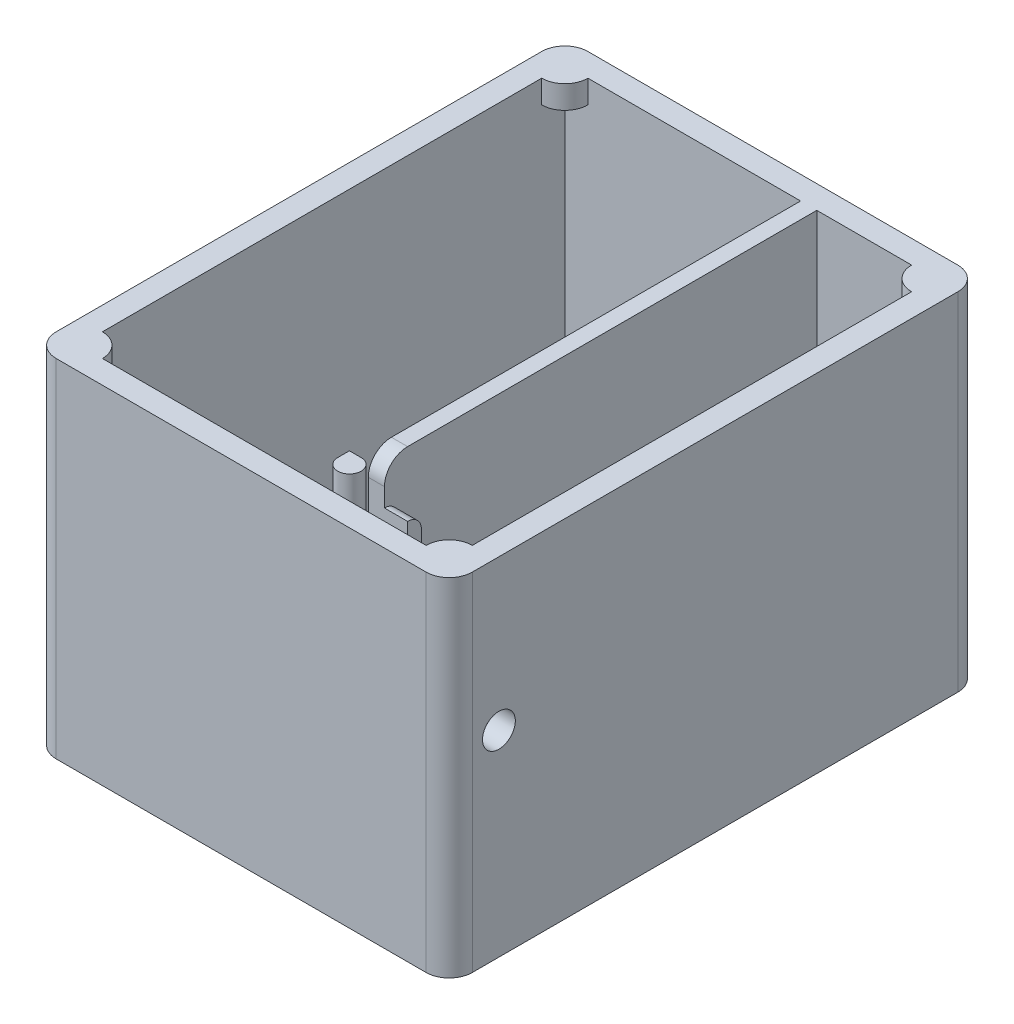
from build123d import *
from build123d.topology import SkipClean

# Parameters (mm, degrees)
SKETCH1_W                = 90
SKETCH1_H                = 115
BOSS_EXTRUDE1_DEPTH      = 70
SKETCH6_W                = 32
SKETCH6_H                = 11.5
CUT_EXTRUDE2_DEPTH       = 65.5
CUT_EXTRUDE11_DEPTH      = 125.222582488
CUT_EXTRUDE11_DEPTH_BACK = 125.222582488
SKETCH22_R               = 3.55
SKETCH2_W                = 25.5
SKETCH2_H                = 90.5
CUT_EXTRUDE12_DEPTH      = 65.5
SKETCH23_W               = 15.5
SKETCH23_H               = 55.5
CUT_EXTRUDE13_DEPTH      = 3
SKETCH24_W               = 14.034874412
SKETCH24_H               = 3
CUT_EXTRUDE14_DEPTH      = 3
FILLET2_R                = 5
FILLET3_R                = 5
FILLET4_R                = 5
FILLET5_R                = 5
SKETCH37_W               = 51
SKETCH37_H               = 105
CUT_EXTRUDE15_DEPTH      = 65.5
BOSS_EXTRUDE3_DEPTH      = 21.5
BOSS_EXTRUDE4_START      = 5
SKETCH44_R               = 5
BOSS_EXTRUDE4_DEPTH      = 5
BOSS_EXTRUDE6_START      = 5
SKETCH48_W               = 80
SKETCH48_H               = 5
SKETCH48_W_2             = 5
SKETCH48_H_2             = 105
BOSS_EXTRUDE6_DEPTH      = 5
SKETCH53_W               = 3.5
SKETCH53_H               = 93.5
BOSS_EXTRUDE7_DEPTH      = 5
SKETCH54_W               = 25.5
SKETCH54_H               = 3
CUT_EXTRUDE16_DEPTH      = 4
CUT_EXTRUDE17_DEPTH      = 5
CUT_EXTRUDE18_START      = -5
CUT_EXTRUDE18_DEPTH      = 5
FILLET6_R                = 5


with BuildPart() as part:
    # Sketch1 → Boss-Extrude1 (new body)
    with BuildSketch(Plane(origin=(0, 0, 0), x_dir=(1, 0, 0), z_dir=(0, 1, 0))):
        Rectangle(SKETCH1_W, SKETCH1_H)
    extrude(amount=BOSS_EXTRUDE1_DEPTH)

    # Sketch6 → Cut-Extrude2 (cut)
    with BuildSketch(Plane(origin=(0, 70, 0), x_dir=(1, 0, 0), z_dir=(0, 1, 0))):
        with Locations((24, -46.75)):
            Rectangle(SKETCH6_W, SKETCH6_H)
    extrude(amount=-CUT_EXTRUDE2_DEPTH, mode=Mode.SUBTRACT)

    # Sketch22 → Cut-Extrude11 (cut, two sides: drawn at the far end of the back side and taken through both)
    with BuildSketch(Plane.ZY.offset(-40).offset(-CUT_EXTRUDE11_DEPTH_BACK)):
        with Locations((46.75, 42.5)):
            Circle(SKETCH22_R)
    extrude(amount=CUT_EXTRUDE11_DEPTH + CUT_EXTRUDE11_DEPTH_BACK, mode=Mode.SUBTRACT)

    # Sketch2 → Cut-Extrude12 (cut)
    with BuildSketch(Plane(origin=(0, 70, 0), x_dir=(1, 0, 0), z_dir=(0, 1, 0))):
        with Locations((27.25, 7.25)):
            Rectangle(SKETCH2_W, SKETCH2_H)
    extrude(amount=-CUT_EXTRUDE12_DEPTH, mode=Mode.SUBTRACT)

    # Sketch23 → Cut-Extrude13 (cut)
    with BuildSketch(Plane(origin=(0, 0, 38), x_dir=(-1, 0, 0), z_dir=(0, 0, -1))):
        with Locations((-27.25, 38.25)):
            Rectangle(SKETCH23_W, SKETCH23_H)
    extrude(amount=-CUT_EXTRUDE13_DEPTH, mode=Mode.SUBTRACT)

    # Sketch24 → Cut-Extrude14 (cut)
    with BuildSketch(Plane(origin=(0, 0, 38), x_dir=(-1, 0, 0), z_dir=(0, 0, -1))):
        with Locations((-14.5, 19.5)):
            Rectangle(SKETCH24_W, SKETCH24_H)
    extrude(amount=-CUT_EXTRUDE14_DEPTH, mode=Mode.SUBTRACT)

    # Fillet2
    fillet2_edges = [part.edges().sort_by_distance(p)[0] for p in [
        (-45, 35, 57.5),
    ]]
    fillet(fillet2_edges, radius=FILLET2_R)

    # Fillet3
    fillet3_edges = [part.edges().sort_by_distance(p)[0] for p in [
        (45, 35, 57.5),
    ]]
    fillet(fillet3_edges, radius=FILLET3_R)

    # Fillet4
    fillet4_edges = [part.edges().sort_by_distance(p)[0] for p in [
        (45, 35, -57.5),
    ]]
    fillet(fillet4_edges, radius=FILLET4_R)

    # Fillet5
    fillet5_edges = [part.edges().sort_by_distance(p)[0] for p in [
        (-45, 35, -57.5),
    ]]
    fillet(fillet5_edges, radius=FILLET5_R)

    # Sketch37 → Cut-Extrude15 (cut)
    with BuildSketch(Plane(origin=(0, 70, 0), x_dir=(1, 0, 0), z_dir=(0, 1, 0))):
        with Locations((-14.5, 0)):
            Rectangle(SKETCH37_W, SKETCH37_H)
    extrude(amount=-CUT_EXTRUDE15_DEPTH, mode=Mode.SUBTRACT)

    # Sketch39 → Boss-Extrude3 (add)
    with BuildSketch(Plane(origin=(0, 4.5, 0), x_dir=(1, 0, 0), z_dir=(0, 1, 0))):
        with BuildLine():
            Line((10.8, 3.38), (10.8, 5.92))
            Line((10.8, 5.92), (8.26, 5.92))
            ThreePointArc((8.26, 5.92), (6.463948776, 1.583948776), (10.8, 3.38))
        make_face()
        with BuildLine():
            ThreePointArc((10.8, -49.96), (6.463948776, -48.163948776), (8.26, -52.5))
            Line((8.26, -52.5), (10.8, -52.5))
            Line((10.8, -52.5), (10.8, -49.96))
        make_face()
        with BuildLine():
            ThreePointArc((-37.46, -52.5), (-35.663948776, -48.163948776), (-40, -49.96))
            Line((-40, -49.96), (-40, -52.5))
            Line((-40, -52.5), (-37.46, -52.5))
        make_face()
        with BuildLine():
            Line((-37.46, 5.92), (-40, 5.92))
            Line((-40, 5.92), (-40, 3.38))
            ThreePointArc((-40, 3.38), (-35.663948776, 1.583948776), (-37.46, 5.92))
        make_face()
    extrude(amount=BOSS_EXTRUDE3_DEPTH)

    # Sketch44 → Boss-Extrude4 (add)
    with SkipClean():  # the faces are left unmerged after this step: merging them gives an invalid solid
        with BuildSketch(Plane(origin=(0, 70, 0), x_dir=(1, 0, 0), z_dir=(0, 1, 0)).offset(BOSS_EXTRUDE4_START)):
            with Locations((40, 52.5)):
                Circle(SKETCH44_R)
            with Locations((-40, 52.5)):
                Circle(SKETCH44_R)
            with Locations((-40, -52.5)):
                Circle(SKETCH44_R)
            with Locations((40, -52.5)):
                Circle(SKETCH44_R)
        extrude(amount=-BOSS_EXTRUDE4_DEPTH)

    # Sketch48 → Boss-Extrude6 (add)
    with SkipClean():  # the faces are left unmerged after this step: merging them gives an invalid solid
        with BuildSketch(Plane(origin=(0, 70, 0), x_dir=(1, 0, 0), z_dir=(0, 1, 0)).offset(BOSS_EXTRUDE6_START)):
            with Locations((0, 55)):
                Rectangle(SKETCH48_W, SKETCH48_H)
            with Locations((-42.5, 0)):
                Rectangle(SKETCH48_W_2, SKETCH48_H_2)
            with BuildLine():
                Line((45, -52.5), (45, 52.5))
                ThreePointArc((45, 52.5), (43.535533906, 48.964466094), (40, 47.5))
                Line((40, 47.5), (40, -47.5))
                ThreePointArc((40, -47.5), (43.535533906, -48.964466094), (45, -52.5))
            make_face()
            with Locations((0, -55)):
                Rectangle(SKETCH48_W, SKETCH48_H)
        extrude(amount=-BOSS_EXTRUDE6_DEPTH)
    add(part.part.scale(1), mode=Mode.REPLACE)  # the faces are merged on a copy

    # Sketch53 → Boss-Extrude7 (add)
    with BuildSketch(Plane(origin=(0, 70, 0), x_dir=(1, 0, 0), z_dir=(0, 1, 0))):
        with Locations((12.75, 5.75)):
            Rectangle(SKETCH53_W, SKETCH53_H)
    extrude(amount=BOSS_EXTRUDE7_DEPTH)

    # Sketch54 → Cut-Extrude16 (cut)
    with BuildSketch(Plane(origin=(0, 70, 0), x_dir=(1, 0, 0), z_dir=(0, 1, 0))):
        with Locations((27.25, -39.5)):
            Rectangle(SKETCH54_W, SKETCH54_H)
    extrude(amount=-CUT_EXTRUDE16_DEPTH, mode=Mode.SUBTRACT)

    # Sketch55 → Cut-Extrude17 (cut)
    with BuildSketch(Plane(origin=(19.5, 0, 0), x_dir=(0, 0, -1), z_dir=(1, 0, 0))):
        with BuildLine():
            Line((-38, 66), (-41, 66))
            ThreePointArc((-41, 66), (-38.878679656, 65.121320344), (-38, 63))
            Line((-38, 63), (-38, 66))
        make_face()
    extrude(amount=-CUT_EXTRUDE17_DEPTH, mode=Mode.SUBTRACT)

    # Sketch56 → Cut-Extrude18 (cut)
    with BuildSketch(Plane.ZY.offset(-35).offset(CUT_EXTRUDE18_START)):
        with BuildLine():
            Line((38, 66), (41, 66))
            ThreePointArc((41, 66), (38.878679656, 65.121320344), (38, 63))
            Line((38, 63), (38, 66))
        make_face()
    extrude(amount=CUT_EXTRUDE18_DEPTH, mode=Mode.SUBTRACT)

    # Fillet6
    fillet6_edges = [part.edges().sort_by_distance(p)[0] for p in [
        (12.75, 75, 41),
    ]]
    fillet(fillet6_edges, radius=FILLET6_R)


solid = part.part
